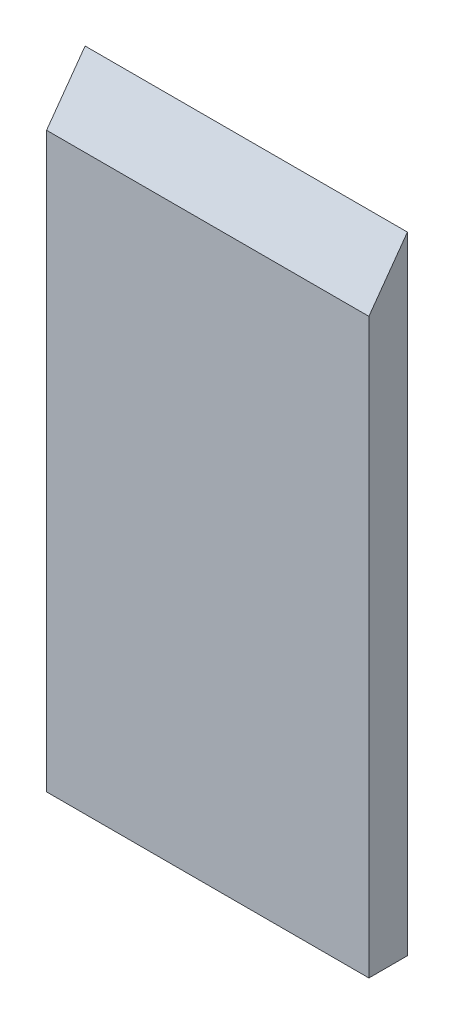
from build123d import *

# Parameters (mm, degrees)
CROQUIS1_W              = 360
CROQUIS1_H              = 43.01
SALIENTE_EXTRUIR1_DEPTH = 700
CORTAR_EXTRUIR4_DEPTH   = 360


with BuildPart() as part:
    # Croquis1 → Saliente-Extruir1 (new body)
    with BuildSketch(Plane(origin=(0, 0, 0), x_dir=(1, 0, 0), z_dir=(0, 1, 0))):
        with Locations((10.078125, 23.172734375)):
            Rectangle(CROQUIS1_W, CROQUIS1_H)
    extrude(amount=SALIENTE_EXTRUIR1_DEPTH)

    # Croquis5 → Cortar-Extruir4 (cut)
    with BuildSketch(Plane(origin=(190.078125, 0, 0), x_dir=(0, 0, -1), z_dir=(1, 0, 0))):
        Polygon((44.677734375, 700), (1.667734375, 640), (1.667734375, 700), align=None)
    extrude(amount=-CORTAR_EXTRUIR4_DEPTH, mode=Mode.SUBTRACT)


solid = part.part
